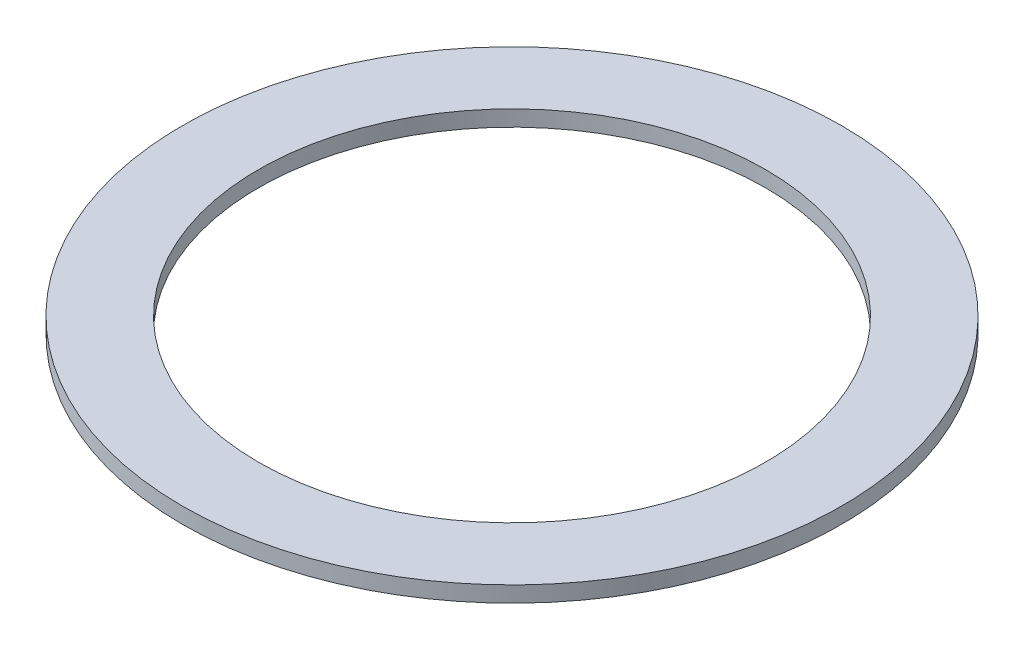
from build123d import *

# Parameters (mm, degrees)
SKETCH1_R           = 33.02
SKETCH1_R_2         = 25.4
BOSS_EXTRUDE1_DEPTH = 1.5875


with BuildPart() as part:
    # Sketch1 → Boss-Extrude1 (new body)
    with BuildSketch(Plane(origin=(0, 0, 0), x_dir=(1, 0, 0), z_dir=(0, 1, 0))):
        Circle(SKETCH1_R)
        Circle(SKETCH1_R_2, mode=Mode.SUBTRACT)
    extrude(amount=BOSS_EXTRUDE1_DEPTH)


solid = part.part
